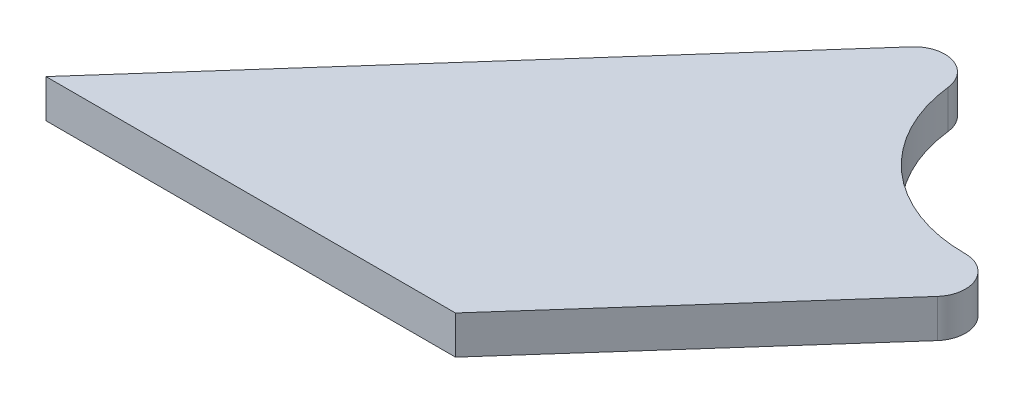
from build123d import *

# Parameters (mm, degrees)
BOSS_EXTRUDE1_DEPTH = 3.175
SKETCH2_R           = 12.7
CUT_EXTRUDE1_DEPTH  = 64.579325453
FILLET1_R           = 2.54


with BuildPart() as part:
    # Sketch1 → Boss-Extrude1 (new body)
    with BuildSketch(Plane(origin=(0, 0, 0), x_dir=(1, 0, 0), z_dir=(0, 1, 0))):
        with BuildLine():
            Line((-9.498044736, 8.430726315), (-50.8, -38.1))
            Line((-50.8, -38.1), (-16.8372204, -38.1))
            Line((-16.8372204, -38.1), (9.498044736, -8.430726315))
            ThreePointArc((9.498044736, -8.430726315), (8.430726315, 9.498044736), (-9.498044736, 8.430726315))
        make_face()
    extrude(amount=BOSS_EXTRUDE1_DEPTH)

    # Sketch2 → Cut-Extrude1 (cut, through all)
    with BuildSketch(Plane.XZ):
        Circle(SKETCH2_R)
    extrude(amount=-CUT_EXTRUDE1_DEPTH, mode=Mode.SUBTRACT)

    # Fillet1
    fillet1_edges = [part.edges().sort_by_distance(p)[0] for p in [
        (9.498044736, 1.5875, 8.430726315),
    ]]
    fillet(fillet1_edges, radius=FILLET1_R)
    fillet1_2_edges = [part.edges().sort_by_distance(p)[0] for p in [
        (-9.498044736, 1.5875, -8.430726315),
    ]]
    fillet(fillet1_2_edges, radius=FILLET1_R)


solid = part.part
